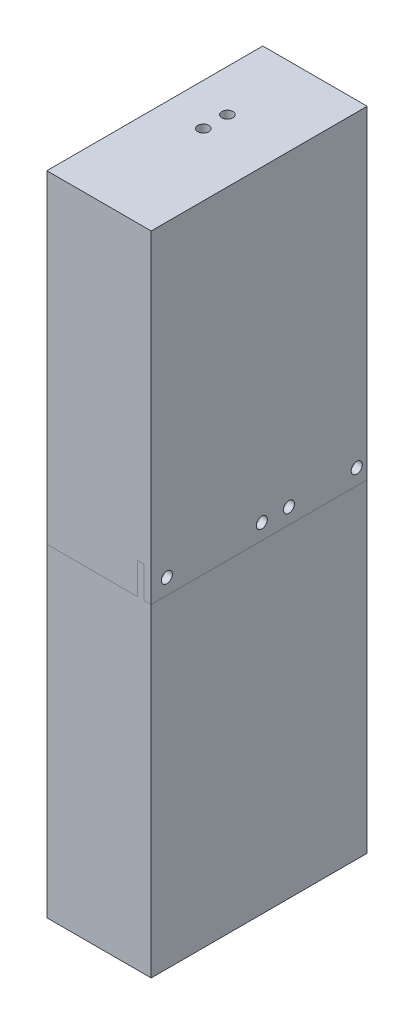
from build123d import *

# Parameters (mm, degrees)
SKETCH1_W               = 69
SKETCH1_H               = 280
BOSS_EXTRUDE1_DEPTH     = 10
CUT_EXTRUDE1_DEPTH      = 243.372314788
CUT_EXTRUDE1_DEPTH_BACK = 243.372314788
SKETCH2_W               = 2.5
SKETCH2_H               = 280
SKETCH3_W               = 10
SKETCH3_H               = 280
SKETCH3_W_2             = 2
BOSS_EXTRUDE2_DEPTH     = 10
SKETCH4_W               = 10
SKETCH4_H               = 78.5
BOSS_EXTRUDE3_DEPTH     = 10
SKETCH5_W               = 50
SKETCH5_H               = 10
SKETCH5_H_2             = 15
SKETCH5_W_2             = 40
BOSS_EXTRUDE4_DEPTH     = 290
SKETCH6_W               = 78.5
SKETCH6_H               = 10
CUT_EXTRUDE3_DEPTH      = 40
SKETCH7_W               = 50
SKETCH7_H               = 103.5
BOSS_EXTRUDE5_DEPTH     = 10
SKETCH8_W               = 50
SKETCH8_H               = 103.5
BOSS_EXTRUDE6_DEPTH     = 10
CUT_EXTRUDE5_DEPTH      = 270.277994006
CUT_EXTRUDE5_DEPTH_BACK = 270.277994006
SKETCH12_R              = 2.65
SPLIT1_START            = -40
SPLIT1_OUTLINE_W        = 120
SPLIT1_OUTLINE_H        = 10
SPLIT1_DEPTH            = 50
SPLIT1_2_DEPTH          = 10
SPLIT1_3_OUTLINE_W      = 15
SPLIT1_3_OUTLINE_H      = 10
SPLIT1_3_OUTLINE_R      = 2.65
SPLIT1_3_OUTLINE_H_2    = 15
SPLIT1_3_DEPTH          = 43.33
SPLIT1_START_2          = 6.67
SPLIT1_4_OUTLINE_W      = 15
SPLIT1_4_OUTLINE_H      = 103.5
SPLIT1_4_OUTLINE_R      = 2.65
SPLIT1_4_DEPTH          = 3.33
SPLIT1_5_OUTLINE_W      = 15
SPLIT1_5_OUTLINE_H      = 10
SPLIT1_5_OUTLINE_H_2    = 28.5
SPLIT1_5_OUTLINE_R      = 2.65
SPLIT1_5_OUTLINE_H_3    = 20
SPLIT1_5_DEPTH          = 3.33
SPLIT1_6_OUTLINE_W      = 140
SPLIT1_6_OUTLINE_H      = 103.5
SPLIT1_6_DEPTH          = 50
SPLIT1_7_OUTLINE_W      = 15
SPLIT1_7_OUTLINE_H      = 103.5
SPLIT1_7_OUTLINE_R      = 2.65
SPLIT1_7_DEPTH          = 43.33
SPLIT1_8_OUTLINE_W      = 15
SPLIT1_8_OUTLINE_H      = 103.5
SPLIT1_8_OUTLINE_R      = 2.65
SPLIT1_8_DEPTH          = 3.33
CUT_EXTRUDE6_DEPTH      = 318.098969673
CUT_EXTRUDE6_DEPTH_BACK = 318.098969673
SKETCH13_R              = 2.65
SKETCH15_R              = 5
CUT_EXTRUDE7_DEPTH      = 5


# Read off the part's stored shape, not the designer's step: Split1
with BuildPart() as part:
    # Sketch1 → Boss-Extrude1 (new body)
    with BuildSketch(Plane(origin=(0, 0, 0), x_dir=(0, 0, -1), z_dir=(1, 0, 0))):
        with Locations((3.598159509, -99.150306748)):
            Rectangle(SKETCH1_W, SKETCH1_H)
    extrude(amount=BOSS_EXTRUDE1_DEPTH)

    # Sketch2 → Cut-Extrude1 (cut, two sides: drawn at the far end of the back side and taken through both)
    with BuildSketch(Plane(origin=(10, 0, 0), x_dir=(0, 0, -1), z_dir=(1, 0, 0)).offset(-CUT_EXTRUDE1_DEPTH_BACK)):
        with Locations((-29.651840491, -99.150306748)):
            Rectangle(SKETCH2_W, SKETCH2_H)
    extrude(amount=CUT_EXTRUDE1_DEPTH + CUT_EXTRUDE1_DEPTH_BACK, mode=Mode.SUBTRACT)

    # Sketch3 → Boss-Extrude2 (add)
    with BuildSketch(Plane(origin=(10, 0, 0), x_dir=(0, 0, -1), z_dir=(1, 0, 0))):
        with Locations((-33.401840491, -99.150306748)):
            Rectangle(SKETCH3_W, SKETCH3_H)
        with Locations((39.098159509, -99.150306748)):
            Rectangle(SKETCH3_W_2, SKETCH3_H)
    extrude(amount=-BOSS_EXTRUDE2_DEPTH)

    # Sketch4 → Boss-Extrude3 (add)
    with BuildSketch(Plane.XZ.offset(239.150306748)):
        with Locations((5, -0.848159509)):
            Rectangle(SKETCH4_W, SKETCH4_H)
    extrude(amount=BOSS_EXTRUDE3_DEPTH)

    # Sketch5 → Boss-Extrude4 (add)
    with BuildSketch(Plane.XZ.offset(249.150306748)):
        with Locations((-15, -45.098159509)):
            Rectangle(SKETCH5_W, SKETCH5_H)
        with Locations((-15, 45.901840491)):
            Rectangle(SKETCH5_W, SKETCH5_H_2)
        with Locations((-20, 13.401840491)):
            Rectangle(SKETCH5_W_2, SKETCH5_H)
        with Locations((-20, -25.098159509)):
            Rectangle(SKETCH5_W_2, SKETCH5_H)
    extrude(amount=-BOSS_EXTRUDE4_DEPTH)

    # Sketch6 → Cut-Extrude3 (cut)
    with BuildSketch(Plane.ZY.offset(40)):
        with Locations((-0.848159509, 35.849693252)):
            Rectangle(SKETCH6_W, SKETCH6_H)
        with Locations((-0.848159509, -244.150306748)):
            Rectangle(SKETCH6_W, SKETCH6_H)
    extrude(amount=-CUT_EXTRUDE3_DEPTH, mode=Mode.SUBTRACT)

    # Sketch7 → Boss-Extrude5 (add)
    with BuildSketch(Plane(origin=(0, 40.849693252, 0), x_dir=(1, 0, 0), z_dir=(0, 1, 0))):
        with Locations((-15, -1.651840491)):
            Rectangle(SKETCH7_W, SKETCH7_H)
    extrude(amount=BOSS_EXTRUDE5_DEPTH)

    # Sketch8 → Boss-Extrude6 (add)
    with BuildSketch(Plane.XZ.offset(249.150306748)):
        with Locations((-15, 1.651840491)):
            Rectangle(SKETCH8_W, SKETCH8_H)
    extrude(amount=BOSS_EXTRUDE6_DEPTH)

    # Sketch12 → Cut-Extrude5 (cut, two sides: drawn at the far end of the back side and taken through both)
    with BuildSketch(Plane(origin=(10, 0, 0), x_dir=(0, 0, -1), z_dir=(1, 0, 0)).offset(-CUT_EXTRUDE5_DEPTH_BACK)):
        with Locations((-45.901840491, -96.650306748)):
            Circle(SKETCH12_R)
        with Locations((45.098159509, -96.650306748)):
            Circle(SKETCH12_R)
        with Locations((-0.401840491, -96.650306748)):
            Circle(SKETCH12_R)
        with Locations((12.598159509, -96.650306748)):
            Circle(SKETCH12_R)
    extrude(amount=CUT_EXTRUDE5_DEPTH + CUT_EXTRUDE5_DEPTH_BACK, mode=Mode.SUBTRACT)

    # Split1 6 outline → Split1 6 (cut)
    with BuildSketch(Plane.YZ.offset(SPLIT1_START)):
        with Locations((-19.150306748, 1.651840491)):
            Rectangle(SPLIT1_6_OUTLINE_W, SPLIT1_6_OUTLINE_H)
    extrude(amount=SPLIT1_6_DEPTH, mode=Mode.SUBTRACT)

    # Split1 7 outline → Split1 7 (cut)
    with BuildSketch(Plane.YZ.offset(SPLIT1_START)):
        with Locations((-96.650306748, 1.651840491)):
            Rectangle(SPLIT1_7_OUTLINE_W, SPLIT1_7_OUTLINE_H)
        with Locations((-96.650306748, -45.098159509)):
            Circle(SPLIT1_7_OUTLINE_R, mode=Mode.SUBTRACT)
        with Locations((-96.650306748, 0.401840491)):
            Circle(SPLIT1_7_OUTLINE_R, mode=Mode.SUBTRACT)
        with Locations((-96.650306748, -12.598159509)):
            Circle(SPLIT1_7_OUTLINE_R, mode=Mode.SUBTRACT)
        with Locations((-96.650306748, 45.901840491)):
            Circle(SPLIT1_7_OUTLINE_R, mode=Mode.SUBTRACT)
    extrude(amount=SPLIT1_7_DEPTH, mode=Mode.SUBTRACT)

    # Split1 8 outline → Split1 8 (cut)
    with BuildSketch(Plane.YZ.offset(SPLIT1_START_2)):
        with Locations((-96.650306748, 1.651840491)):
            Rectangle(SPLIT1_8_OUTLINE_W, SPLIT1_8_OUTLINE_H)
        with Locations((-96.650306748, -45.098159509)):
            Circle(SPLIT1_8_OUTLINE_R, mode=Mode.SUBTRACT)
        with Locations((-96.650306748, 0.401840491)):
            Circle(SPLIT1_8_OUTLINE_R, mode=Mode.SUBTRACT)
        with Locations((-96.650306748, -12.598159509)):
            Circle(SPLIT1_8_OUTLINE_R, mode=Mode.SUBTRACT)
        with Locations((-96.650306748, 45.901840491)):
            Circle(SPLIT1_8_OUTLINE_R, mode=Mode.SUBTRACT)
    extrude(amount=SPLIT1_8_DEPTH, mode=Mode.SUBTRACT)


with BuildPart() as body_2:
    # Split1 outline → Split1 (new body)
    with BuildSketch(Plane.YZ.offset(SPLIT1_START)):
        Polygon((-89.150306748, -40.098159509), (-89.150306748, -50.098159509), (50.849693252, -50.098159509), (50.849693252, 53.401840491), (-89.150306748, 53.401840491), (-89.150306748, 38.401840491), (40.849693252, 38.401840491), (40.849693252, -40.098159509), align=None)
        with Locations((-29.150306748, -25.098159509)):
            Rectangle(SPLIT1_OUTLINE_W, SPLIT1_OUTLINE_H)
        with Locations((-29.150306748, 13.401840491)):
            Rectangle(SPLIT1_OUTLINE_W, SPLIT1_OUTLINE_H)
    extrude(amount=SPLIT1_DEPTH)

    # Split1 2 outline → Split1 2 (add)
    with BuildSketch(Plane.YZ):
        Polygon((-89.150306748, -30.098159509), (-89.150306748, -40.098159509), (40.849693252, -40.098159509), (40.849693252, 38.401840491), (-89.150306748, 38.401840491), (-89.150306748, 18.401840491), (30.849693252, 18.401840491), (30.849693252, 8.401840491), (-89.150306748, 8.401840491), (-89.150306748, -20.098159509), (30.849693252, -20.098159509), (30.849693252, -30.098159509), align=None)
    extrude(amount=SPLIT1_2_DEPTH)

    # Split1 3 outline → Split1 3 (add)
    # profile 1 of 4: a face of its own
    with BuildSketch(Plane.YZ.offset(SPLIT1_START)):
        with Locations((-96.650306748, -45.098159509)):
            Rectangle(SPLIT1_3_OUTLINE_W, SPLIT1_3_OUTLINE_H)
        with Locations((-96.650306748, -45.098159509)):
            Circle(SPLIT1_3_OUTLINE_R, mode=Mode.SUBTRACT)
    # profile 2 of 4: a face of its own
    with BuildSketch(Plane.YZ.offset(SPLIT1_START)):
        with Locations((-96.650306748, -25.098159509)):
            Rectangle(SPLIT1_3_OUTLINE_W, SPLIT1_3_OUTLINE_H)
    # profile 3 of 4: a face of its own
    with BuildSketch(Plane.YZ.offset(SPLIT1_START)):
        with Locations((-96.650306748, 13.401840491)):
            Rectangle(SPLIT1_3_OUTLINE_W, SPLIT1_3_OUTLINE_H)
    # profile 4 of 4: a face of its own
    with BuildSketch(Plane.YZ.offset(SPLIT1_START)):
        with Locations((-96.650306748, 45.901840491)):
            Rectangle(SPLIT1_3_OUTLINE_W, SPLIT1_3_OUTLINE_H_2)
        with Locations((-96.650306748, 45.901840491)):
            Circle(SPLIT1_3_OUTLINE_R, mode=Mode.SUBTRACT)
    extrude(amount=SPLIT1_3_DEPTH)

    # Split1 4 outline → Split1 4 (add)
    with BuildSketch(Plane.YZ.offset(SPLIT1_START_2)):
        with Locations((-96.650306748, 1.651840491)):
            Rectangle(SPLIT1_4_OUTLINE_W, SPLIT1_4_OUTLINE_H)
        with Locations((-96.650306748, -45.098159509)):
            Circle(SPLIT1_4_OUTLINE_R, mode=Mode.SUBTRACT)
        with Locations((-96.650306748, 0.401840491)):
            Circle(SPLIT1_4_OUTLINE_R, mode=Mode.SUBTRACT)
        with Locations((-96.650306748, -12.598159509)):
            Circle(SPLIT1_4_OUTLINE_R, mode=Mode.SUBTRACT)
        with Locations((-96.650306748, 45.901840491)):
            Circle(SPLIT1_4_OUTLINE_R, mode=Mode.SUBTRACT)
    extrude(amount=SPLIT1_4_DEPTH)

    # Split1 5 outline → Split1 5 (add)
    # profile 1 of 3: a face of its own
    with BuildSketch(Plane.YZ):
        with Locations((-96.650306748, -35.098159509)):
            Rectangle(SPLIT1_5_OUTLINE_W, SPLIT1_5_OUTLINE_H)
    # profile 2 of 3: a face of its own
    with BuildSketch(Plane.YZ):
        with Locations((-96.650306748, -5.848159509)):
            Rectangle(SPLIT1_5_OUTLINE_W, SPLIT1_5_OUTLINE_H_2)
        with Locations((-96.650306748, -12.598159509)):
            Circle(SPLIT1_5_OUTLINE_R, mode=Mode.SUBTRACT)
        with Locations((-96.650306748, 0.401840491)):
            Circle(SPLIT1_5_OUTLINE_R, mode=Mode.SUBTRACT)
    # profile 3 of 3: a face of its own
    with BuildSketch(Plane.YZ):
        with Locations((-96.650306748, 28.401840491)):
            Rectangle(SPLIT1_5_OUTLINE_W, SPLIT1_5_OUTLINE_H_3)
    extrude(amount=SPLIT1_5_DEPTH)


with BuildPart() as cut_extrude6_tool:
    # Sketch13 → Cut-Extrude6 (new, two sides: drawn at the far end of the back side and taken through both)
    with BuildSketch(Plane(origin=(0, 50.849693252, 0), x_dir=(1, 0, 0), z_dir=(0, 1, 0)).offset(-CUT_EXTRUDE6_DEPTH_BACK)):
        with Locations(Location((-20, 13.098159509, 0), (0, 0, 270))):
            Circle(SKETCH13_R)
        with Locations(Location((-20, 1.598159509, 0), (0, 0, 270))):
            Circle(SKETCH13_R)
    extrude(amount=CUT_EXTRUDE6_DEPTH + CUT_EXTRUDE6_DEPTH_BACK)


with BuildPart() as part_1:
    add(part.part)

    # Cut-Extrude6: cut by cut_extrude6_tool
    add(cut_extrude6_tool.part, mode=Mode.SUBTRACT)

    # Sketch15 → Cut-Extrude7 (cut)
    with BuildSketch(Plane.XZ.offset(259.150306748)):
        with Locations(Location((-20, -1.598159509, 0), (0, 0, 270))):
            Circle(SKETCH15_R)
        with Locations(Location((-20, -13.098159509, 0), (0, 0, 270))):
            Circle(SKETCH15_R)
    extrude(amount=-CUT_EXTRUDE7_DEPTH, mode=Mode.SUBTRACT)


with BuildPart() as body_2_1:
    add(body_2.part)

    # Cut-Extrude6: cut by cut_extrude6_tool
    add(cut_extrude6_tool.part, mode=Mode.SUBTRACT)


solid = Compound([part_1.part, body_2_1.part])
